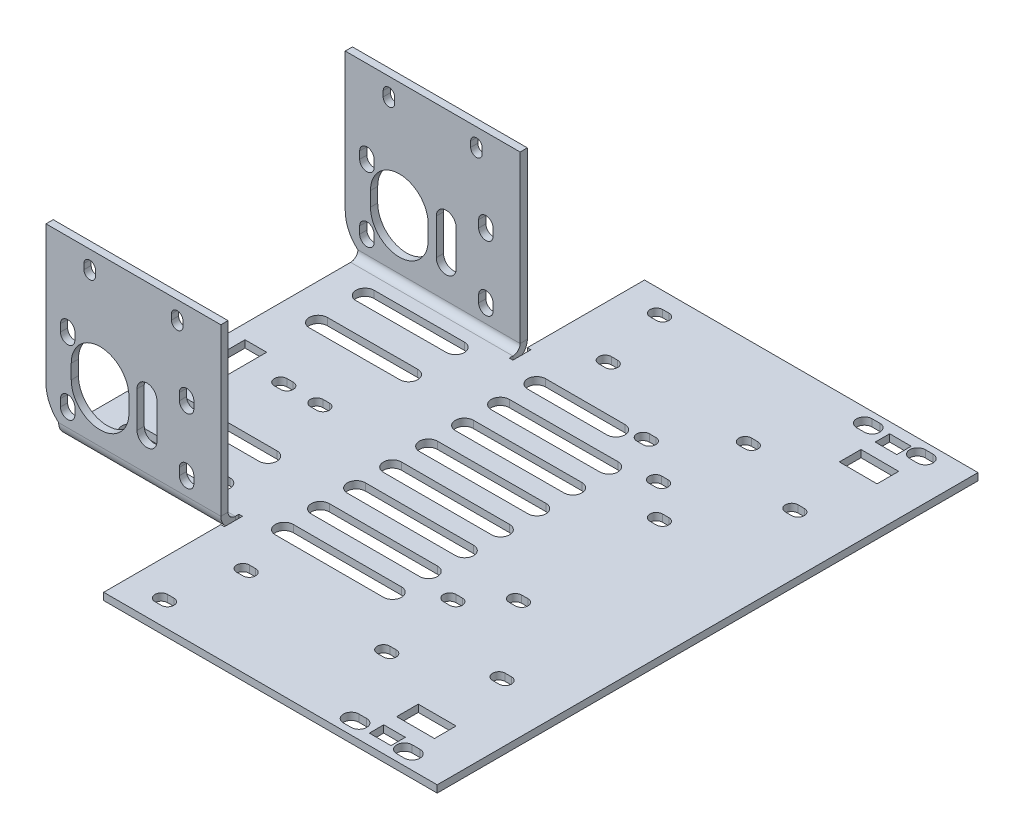
from build123d import *

# Parameters (mm, degrees)
BASE_FLANGE1_DEPTH      = 2
EDGE_FLANGE1_START      = -70.105533496
EDGE_FLANGE1_DEPTH      = 46
EDGE_FLANGE1_START_2    = -25.105533496
EDGE_FLANGE1_2_DEPTH    = 1
EDGE_FLANGE1_3_DEPTH    = 45
SKETCH21_W              = 9.5
SKETCH21_H              = 150
CUT_EXTRUDE1_DEPTH      = 10
SKETCH22_W              = 3.5
SKETCH22_H              = 2
BOSS_EXTRUDE1_DEPTH     = 31
FILLET1_R               = 10
SKETCH23_R              = 2
SKETCH23_R_2            = 8
CUT_EXTRUDE2_DEPTH      = 174
SKETCH24_R              = 2.15
SKETCH24_R_2            = 1.75
SKETCH24_W              = 6
SKETCH24_H              = 10.5
SKETCH24_W_2            = 10.5
SKETCH24_H_2            = 6
SKETCH24_H_3            = 4
CUT_EXTRUDE3_DEPTH      = 174
SKETCH25_W              = 2
SKETCH25_H              = 15
BOSS_EXTRUDE2_DEPTH     = 48.5
SKETCH26_R              = 1.75
CUT_EXTRUDE4_DEPTH      = 10
CUT_EXTRUDE5_DEPTH      = 146.127614744
CUT_EXTRUDE5_DEPTH_BACK = 146.127614744
SKETCH27_R              = 1.5
CUT_EXTRUDE6_START      = -85
CUT_EXTRUDE6_OUTLINE_R  = 1.5
CUT_EXTRUDE6_DEPTH      = 85
CUT_EXTRUDE7_DEPTH      = 124
CUT_EXTRUDE8_DEPTH      = 124
CUT_EXTRUDE9_DEPTH      = 10


# Read off the part's stored shape, not the designer's step: Edge-Flange1, Cut-Extrude6
# Sheet-metal steps are written as plain solids
with BuildPart() as part:
    # Sketch1 → Base-Flange1 (new body)
    with BuildSketch(Plane(origin=(0, 0, 0), x_dir=(1, 0, 0), z_dir=(0, 1, 0))):
        Polygon((-25.105533496, 74.882868115), (-25.105533496, 42.382868115), (-70.105533496, 42.382868115), (-70.105533496, -42.617131885), (-25.105533496, -42.617131885), (-25.105533496, -75.117131885), (76.894466504, -75.117131885), (76.894466504, 74.882868115), align=None)
    extrude(amount=-BASE_FLANGE1_DEPTH)

    # Edge-Flange1 outline → Edge-Flange1 (cut)
    with BuildSketch(Plane.YZ.offset(EDGE_FLANGE1_START)):
        with BuildLine():
            ThreePointArc((0, -41.84696973), (-1.464101615, -40.382868115), (-2, -38.382868115))
            Line((-2, -38.382868115), (-2, -42.382868115))
            Line((-2, -42.382868115), (0, -42.382868115))
            Line((0, -42.382868115), (0, -41.84696973))
        make_face()
        with BuildLine():
            Line((-2, 42.617131885), (-2, 38.617131885))
            ThreePointArc((-2, 38.617131885), (-1.464101615, 40.617131885), (0, 42.081233501))
            Line((0, 42.081233501), (0, 42.617131885))
            Line((0, 42.617131885), (-2, 42.617131885))
        make_face()
    extrude(amount=EDGE_FLANGE1_DEPTH, mode=Mode.SUBTRACT)

    # Edge-Flange1 2 outline → Edge-Flange1 2 (cut)
    with BuildSketch(Plane.YZ.offset(EDGE_FLANGE1_START_2)):
        with BuildLine():
            Line((0, -37.382868115), (-2, -37.382868115))
            Line((-2, -37.382868115), (-2, -38.382868115))
            ThreePointArc((-2, -38.382868115), (-1.464101615, -40.382868115), (0, -41.84696973))
            Line((0, -41.84696973), (0, -37.382868115))
        make_face()
        with BuildLine():
            Line((-2, 38.617131885), (-2, 37.617131885))
            Line((-2, 37.617131885), (0, 37.617131885))
            Line((0, 37.617131885), (0, 42.081233501))
            ThreePointArc((0, 42.081233501), (-1.464101615, 40.617131885), (-2, 38.617131885))
        make_face()
    extrude(amount=EDGE_FLANGE1_2_DEPTH, mode=Mode.SUBTRACT)

    # Edge-Flange1 3 outline → Edge-Flange1 3 (add)
    with BuildSketch(Plane.YZ.offset(EDGE_FLANGE1_START)):
        with BuildLine():
            ThreePointArc((2, -40.382868115), (0.585786438, -39.797081677), (0, -38.382868115))
            Line((0, -38.382868115), (0, -41.84696973))
            ThreePointArc((0, -41.84696973), (0.96472382, -42.24657142), (2, -42.382868115))
            Line((2, -42.382868115), (33, -42.382868115))
            Line((33, -42.382868115), (33, -40.382868115))
            Line((33, -40.382868115), (2, -40.382868115))
        make_face()
        with BuildLine():
            Line((0, 42.081233501), (0, 38.617131885))
            ThreePointArc((0, 38.617131885), (0.585786437, 40.031345448), (2, 40.617131885))
            Line((2, 40.617131885), (33, 40.617131885))
            Line((33, 40.617131885), (33, 42.617131885))
            Line((33, 42.617131885), (2, 42.617131885))
            ThreePointArc((2, 42.617131885), (0.96472382, 42.48083519), (0, 42.081233501))
        make_face()
    extrude(amount=EDGE_FLANGE1_3_DEPTH)

    # Sketch21 → Cut-Extrude1 (cut)
    with BuildSketch(Plane(origin=(0, 0, 0), x_dir=(1, 0, 0), z_dir=(0, 1, 0))):
        with Locations((72.144466504, -0.117131885)):
            Rectangle(SKETCH21_W, SKETCH21_H)
    extrude(amount=-CUT_EXTRUDE1_DEPTH, mode=Mode.SUBTRACT)

    # Sketch22 → Boss-Extrude1 (add)
    with BuildSketch(Plane(origin=(0, 33, 0), x_dir=(1, 0, 0), z_dir=(0, 1, 0))):
        with Locations((-71.855533496, -41.617131885)):
            Rectangle(SKETCH22_W, SKETCH22_H)
        with Locations((-71.855533496, 41.382868115)):
            Rectangle(SKETCH22_W, SKETCH22_H)
    extrude(amount=-BOSS_EXTRUDE1_DEPTH)

    # Fillet1
    # the kernel refuses this fillet: 10 mm, written as the material it takes off along each edge
    with BuildSketch(Plane(origin=(-73.605533496, 2, 21.618776693), x_dir=(1, 0, 0), z_dir=(0, 0, 1)), Plane(origin=(-73.605533496, 2, -61.381223307), x_dir=(1, 0, 0), z_dir=(0, 0, 1))) as fillet1_piece_1:
        with BuildLine():
            CenterArc((10, 7.599342077), FILLET1_R, 180, 49.458398126)
            Line((0, 7.599342077), (-0.2, 7.599342077))
            Line((-0.2, 7.599342077), (-0.2, 0))
            Line((-0.2, 0), (0, -0.2))
            ThreePointArc((0, -0.2), (1.75, -0.2), (3.37, -0.151986842))
            Line((3.37, -0.151986842), (3.5, 0))
        make_face()
    extrude(amount=39.996710384, mode=Mode.SUBTRACT)

    # Sketch23 → Cut-Extrude2 (cut)
    with BuildSketch(Plane.XY.offset(42.617131885)):
        with Locations((-67.605533496, 25)):
            Circle(SKETCH23_R)
        with Locations((-67.605533496, 7)):
            Circle(SKETCH23_R)
        with Locations((-34.605533496, 7)):
            Circle(SKETCH23_R)
        with Locations((-34.605533496, 25)):
            Circle(SKETCH23_R)
        with Locations((-58.605533496, 16)):
            Circle(SKETCH23_R_2)
        with BuildLine():
            Line((-48.355533496, 11), (-48.355533496, 21))
            ThreePointArc((-48.355533496, 21), (-45.605533496, 23.75), (-42.855533496, 21))
            Line((-42.855533496, 21), (-42.855533496, 11))
            ThreePointArc((-42.855533496, 11), (-45.605533496, 8.25), (-48.355533496, 11))
        make_face()
    extrude(amount=-CUT_EXTRUDE2_DEPTH, mode=Mode.SUBTRACT)

    # Sketch24 → Cut-Extrude3 (cut)
    with BuildSketch(Plane(origin=(0, -2, 0), x_dir=(-1, 0, 0), z_dir=(0, -1, 0))):
        with Locations(Location((-55.394466504, -71.117131885, 0), (0, 0, 90))):
            Circle(SKETCH24_R)
        with Locations(Location((-40.614466504, -71.117131885, 0), (0, 0, 90))):
            Circle(SKETCH24_R)
        with Locations(Location((-50.894466504, -40.617131885, 0), (0, 0, 90))):
            Circle(SKETCH24_R_2)
        with Locations(Location((-34.394466504, -19.55983664, 0), (0, 0, 90))):
            Circle(SKETCH24_R_2)
        with Locations(Location((-25.144466504, -28.517131885, 0), (0, 0, 90))):
            Circle(SKETCH24_R_2)
        with Locations(Location((-28.394466504, -50.117131885, 0), (0, 0, 90))):
            Circle(SKETCH24_R_2)
        with Locations(Location((10.605533496, -50.117131885, 0), (0, 0, 90))):
            Circle(SKETCH24_R_2)
        with Locations(Location((14.855533496, -68.517131885, 0), (0, 0, 90))):
            Circle(SKETCH24_R_2)
        with Locations(Location((-13.394466504, 36.882868115, 0), (0, 0, 90))):
            Circle(SKETCH24_R_2)
        with Locations(Location((14.617278303, 68.568355765, 0), (0, 0, 90))):
            Circle(SKETCH24_R_2)
        with Locations(Location((10.431262351, 50.153693931, 0), (0, 0, 90))):
            Circle(SKETCH24_R_2)
        with Locations(Location((-28.568502039, 50.01812999, 0), (0, 0, 90))):
            Circle(SKETCH24_R_2)
        with Locations(Location((-25.243440106, 28.429557477, 0), (0, 0, 90))):
            Circle(SKETCH24_R_2)
        with Locations(Location((-34.462248679, 19.44016336, 0), (0, 0, 90))):
            Circle(SKETCH24_R_2)
        with Locations(Location((-51.035344124, 40.439977417, 0), (0, 0, 90))):
            Circle(SKETCH24_R_2)
        with Locations(Location((-40.861424182, 70.975526422, 0), (0, 0, 90))):
            Circle(SKETCH24_R)
        with Locations(Location((-55.641334892, 70.924151164, 0), (0, 0, 90))):
            Circle(SKETCH24_R)
        with Locations((63.155533496, -0.117131885)):
            Rectangle(SKETCH24_W, SKETCH24_H)
        with Locations((-50.644466504, -61.367131885)):
            Rectangle(SKETCH24_W_2, SKETCH24_H_2)
        with Locations((-48.564466504, -70.117131885)):
            Rectangle(SKETCH24_W, SKETCH24_H_3)
        Polygon((-45.814870276, 71.958314188), (-45.800966282, 67.958338353), (-51.800930034, 67.937482362), (-51.814834028, 71.937458197), align=None)
        Polygon((-45.617932315, 64.208951928), (-45.597076324, 58.208988175), (-56.09701289, 58.172490191), (-56.117868881, 64.172453944), align=None)
    extrude(amount=-CUT_EXTRUDE3_DEPTH, mode=Mode.SUBTRACT)

    # Sketch25 → Boss-Extrude2 (add)
    with BuildSketch(Plane.ZY.offset(73.605533496)):
        with Locations((-41.382868115, 40.5)):
            Rectangle(SKETCH25_W, SKETCH25_H)
        with Locations((41.617131885, 40.5)):
            Rectangle(SKETCH25_W, SKETCH25_H)
    extrude(amount=-BOSS_EXTRUDE2_DEPTH)

    # Sketch26 → Cut-Extrude4 (cut)
    with BuildSketch(Plane(origin=(0, 0, 0), x_dir=(1, 0, 0), z_dir=(0, 1, 0))):
        with Locations(Location((-50.155533496, -0.117131885, 0), (0, 0, 270))):
            Circle(SKETCH26_R)
        with Locations(Location((-40.155533496, -0.117131885, 0), (0, 0, 270))):
            Circle(SKETCH26_R)
    extrude(amount=-CUT_EXTRUDE4_DEPTH, mode=Mode.SUBTRACT)

    # Sketch27 → Cut-Extrude5 (cut, two sides: drawn at the far end of the back side and taken through both)
    with BuildSketch(Plane(origin=(0, 0, 40.617131885), x_dir=(-1, 0, 0), z_dir=(0, 0, -1)).offset(-CUT_EXTRUDE5_DEPTH_BACK)):
        with Locations((61.480533496, 43)):
            Circle(SKETCH27_R)
        with Locations((37.230533496, 43)):
            Circle(SKETCH27_R)
    extrude(amount=CUT_EXTRUDE5_DEPTH + CUT_EXTRUDE5_DEPTH_BACK, mode=Mode.SUBTRACT)

    # Cut-Extrude6 outline → Cut-Extrude6 (cut)
    # profile 1 of 12: a face of its own
    with BuildSketch(Plane(origin=(0, 0, -42.382868115), x_dir=(-1, 0, 0), z_dir=(0, 0, -1)).offset(CUT_EXTRUDE6_START)):
        with BuildLine():
            Line((65.605533496, 25), (65.605533496, 24))
            ThreePointArc((65.605533496, 24), (67.605533496, 22), (69.605533496, 24))
            Line((69.605533496, 24), (69.605533496, 25))
            ThreePointArc((69.605533496, 25), (67.605533496, 23), (65.605533496, 25))
        make_face()
    # profile 2 of 12: a face of its own
    with BuildSketch(Plane(origin=(0, 0, -42.382868115), x_dir=(-1, 0, 0), z_dir=(0, 0, -1)).offset(CUT_EXTRUDE6_START)):
        with BuildLine():
            Line((65.605533496, 26), (65.605533496, 25))
            ThreePointArc((65.605533496, 25), (67.605533496, 27), (69.605533496, 25))
            Line((69.605533496, 25), (69.605533496, 26))
            ThreePointArc((69.605533496, 26), (67.605533496, 28), (65.605533496, 26))
        make_face()
    # profile 3 of 12: a face of its own
    with BuildSketch(Plane(origin=(0, 0, -42.382868115), x_dir=(-1, 0, 0), z_dir=(0, 0, -1)).offset(CUT_EXTRUDE6_START)):
        with BuildLine():
            ThreePointArc((69.605533496, 8), (67.605533496, 10), (65.605533496, 8))
            Line((65.605533496, 8), (65.605533496, 7))
            ThreePointArc((65.605533496, 7), (67.605533496, 9), (69.605533496, 7))
            Line((69.605533496, 7), (69.605533496, 8))
        make_face()
    # profile 4 of 12: a face of its own
    with BuildSketch(Plane(origin=(0, 0, -42.382868115), x_dir=(-1, 0, 0), z_dir=(0, 0, -1)).offset(CUT_EXTRUDE6_START)):
        with BuildLine():
            ThreePointArc((69.605533496, 7), (67.605533496, 5), (65.605533496, 7))
            Line((65.605533496, 7), (65.605533496, 6))
            ThreePointArc((65.605533496, 6), (67.605533496, 4), (69.605533496, 6))
            Line((69.605533496, 6), (69.605533496, 7))
        make_face()
    # profile 5 of 12: a face of its own
    with BuildSketch(Plane(origin=(0, 0, -42.382868115), x_dir=(-1, 0, 0), z_dir=(0, 0, -1)).offset(CUT_EXTRUDE6_START)):
        with BuildLine():
            Line((66.605533496, 16), (66.605533496, 18))
            ThreePointArc((66.605533496, 18), (58.605533496, 26), (50.605533496, 18))
            Line((50.605533496, 18), (50.605533496, 16))
            ThreePointArc((50.605533496, 16), (58.605533496, 24), (66.605533496, 16))
        make_face()
    # profile 6 of 12: a face of its own
    with BuildSketch(Plane(origin=(0, 0, -42.382868115), x_dir=(-1, 0, 0), z_dir=(0, 0, -1)).offset(CUT_EXTRUDE6_START)):
        with BuildLine():
            Line((66.605533496, 14), (66.605533496, 16))
            ThreePointArc((66.605533496, 16), (58.605533496, 8), (50.605533496, 16))
            Line((50.605533496, 16), (50.605533496, 14))
            ThreePointArc((50.605533496, 14), (58.605533496, 6), (66.605533496, 14))
        make_face()
    # profile 7 of 12: a face of its own
    with BuildSketch(Plane(origin=(0, 0, -42.382868115), x_dir=(-1, 0, 0), z_dir=(0, 0, -1)).offset(CUT_EXTRUDE6_START)):
        with BuildLine():
            Line((36.605533496, 7), (36.605533496, 8))
            ThreePointArc((36.605533496, 8), (34.605533496, 10), (32.605533496, 8))
            Line((32.605533496, 8), (32.605533496, 7))
            ThreePointArc((32.605533496, 7), (34.605533496, 9), (36.605533496, 7))
        make_face()
    # profile 8 of 12: a face of its own
    with BuildSketch(Plane(origin=(0, 0, -42.382868115), x_dir=(-1, 0, 0), z_dir=(0, 0, -1)).offset(CUT_EXTRUDE6_START)):
        with BuildLine():
            Line((36.605533496, 6), (36.605533496, 7))
            ThreePointArc((36.605533496, 7), (34.605533496, 5), (32.605533496, 7))
            Line((32.605533496, 7), (32.605533496, 6))
            ThreePointArc((32.605533496, 6), (34.605533496, 4), (36.605533496, 6))
        make_face()
    # profile 9 of 12: a face of its own
    with BuildSketch(Plane(origin=(0, 0, -42.382868115), x_dir=(-1, 0, 0), z_dir=(0, 0, -1)).offset(CUT_EXTRUDE6_START)):
        with BuildLine():
            ThreePointArc((32.605533496, 24), (34.605533496, 22), (36.605533496, 24))
            Line((36.605533496, 24), (36.605533496, 25))
            ThreePointArc((36.605533496, 25), (34.605533496, 23), (32.605533496, 25))
            Line((32.605533496, 25), (32.605533496, 24))
        make_face()
    # profile 10 of 12: a face of its own
    with BuildSketch(Plane(origin=(0, 0, -42.382868115), x_dir=(-1, 0, 0), z_dir=(0, 0, -1)).offset(CUT_EXTRUDE6_START)):
        with BuildLine():
            ThreePointArc((32.605533496, 25), (34.605533496, 27), (36.605533496, 25))
            Line((36.605533496, 25), (36.605533496, 26))
            ThreePointArc((36.605533496, 26), (34.605533496, 28), (32.605533496, 26))
            Line((32.605533496, 26), (32.605533496, 25))
        make_face()
    # profile 11 of 12: a face of its own
    with BuildSketch(Plane(origin=(0, 0, -42.382868115), x_dir=(-1, 0, 0), z_dir=(0, 0, -1)).offset(CUT_EXTRUDE6_START)):
        with BuildLine():
            ThreePointArc((38.829731585, 43.749983763), (38.361385906, 44.881071072), (37.230533461, 45.349983562))
            ThreePointArc((37.230533461, 45.349983562), (36.099681016, 44.881071072), (35.631335337, 43.749983763))
            Line((35.631335337, 43.749983763), (35.63053576, 42.250003418))
            ThreePointArc((35.63053576, 42.250003418), (37.230533461, 40.650005716), (38.830531162, 42.250003418))
            Line((38.830531162, 42.250003418), (38.829731585, 43.749983763))
        make_face()
        with Locations((37.230533496, 43)):
            Circle(CUT_EXTRUDE6_OUTLINE_R, mode=Mode.SUBTRACT)
    # profile 12 of 12: a face of its own
    with BuildSketch(Plane(origin=(0, 0, -42.382868115), x_dir=(-1, 0, 0), z_dir=(0, 0, -1)).offset(CUT_EXTRUDE6_START)):
        with BuildLine():
            ThreePointArc((63.079731655, 43.749983763), (62.611385976, 44.881071072), (61.480533531, 45.349983562))
            ThreePointArc((61.480533531, 45.349983562), (60.349681086, 44.881071072), (59.881335407, 43.749983763))
            Line((59.881335407, 43.749983763), (59.88053583, 42.250003418))
            ThreePointArc((59.88053583, 42.250003418), (61.480533531, 40.650005716), (63.080531232, 42.250003418))
            Line((63.080531232, 42.250003418), (63.079731655, 43.749983763))
        make_face()
        with Locations((61.480533496, 43)):
            Circle(CUT_EXTRUDE6_OUTLINE_R, mode=Mode.SUBTRACT)
    extrude(amount=CUT_EXTRUDE6_DEPTH, mode=Mode.SUBTRACT)

    # Sketch29 → Cut-Extrude7 (cut)
    with BuildSketch(Plane(origin=(0, -2, 0), x_dir=(-1, 0, 0), z_dir=(0, -1, 0))):
        with BuildLine():
            Line((-41.689466504, -68.967131885), (-39.539466504, -68.967131885))
            ThreePointArc((-39.539466504, -68.967131885), (-37.389466504, -71.117131885), (-39.539466504, -73.267131885))
            Line((-39.539466504, -73.267131885), (-41.689466504, -73.267131885))
            ThreePointArc((-41.689466504, -73.267131885), (-43.839466504, -71.117131885), (-41.689466504, -68.967131885))
        make_face()
        with BuildLine():
            Line((-35.269466504, -21.30983664), (-33.519466504, -21.30983664))
            ThreePointArc((-33.519466504, -21.30983664), (-31.769466504, -19.55983664), (-33.519466504, -17.80983664))
            Line((-33.519466504, -17.80983664), (-35.269466504, -17.80983664))
            ThreePointArc((-35.269466504, -17.80983664), (-37.019466504, -19.55983664), (-35.269466504, -21.30983664))
        make_face()
        with BuildLine():
            Line((-12.519466504, 38.632868115), (-14.269466504, 38.632868115))
            ThreePointArc((-14.269466504, 38.632868115), (-16.019466504, 36.882868115), (-14.269466504, 35.132868115))
            Line((-14.269466504, 35.132868115), (-12.519466504, 35.132868115))
            ThreePointArc((-12.519466504, 35.132868115), (-10.769466504, 36.882868115), (-12.519466504, 38.632868115))
        make_face()
        with BuildLine():
            Line((-24.269466504, -30.267131885), (-26.019466504, -30.267131885))
            ThreePointArc((-26.019466504, -30.267131885), (-27.769466504, -28.517131885), (-26.019466504, -26.767131885))
            Line((-26.019466504, -26.767131885), (-24.269466504, -26.767131885))
            ThreePointArc((-24.269466504, -26.767131885), (-22.519466504, -28.517131885), (-24.269466504, -30.267131885))
        make_face()
        with BuildLine():
            Line((-27.519466504, -48.367131885), (-29.269466504, -48.367131885))
            ThreePointArc((-29.269466504, -48.367131885), (-31.019466504, -50.117131885), (-29.269466504, -51.867131885))
            Line((-29.269466504, -51.867131885), (-27.519466504, -51.867131885))
            ThreePointArc((-27.519466504, -51.867131885), (-25.769466504, -50.117131885), (-27.519466504, -48.367131885))
        make_face()
        with BuildLine():
            Line((-56.469466504, -73.267131885), (-54.319466504, -73.267131885))
            ThreePointArc((-54.319466504, -73.267131885), (-52.169466504, -71.117131885), (-54.319466504, -68.967131885))
            Line((-54.319466504, -68.967131885), (-56.469466504, -68.967131885))
            ThreePointArc((-56.469466504, -68.967131885), (-58.619466504, -71.117131885), (-56.469466504, -73.267131885))
        make_face()
        with BuildLine():
            Line((11.480533496, -48.367131885), (9.730533496, -48.367131885))
            ThreePointArc((9.730533496, -48.367131885), (7.980533496, -50.117131885), (9.730533496, -51.867131885))
            Line((9.730533496, -51.867131885), (11.480533496, -51.867131885))
            ThreePointArc((11.480533496, -51.867131885), (13.230533496, -50.117131885), (11.480533496, -48.367131885))
        make_face()
        with BuildLine():
            Line((-51.769466504, -42.367131885), (-50.019466504, -42.367131885))
            ThreePointArc((-50.019466504, -42.367131885), (-48.269466504, -40.617131885), (-50.019466504, -38.867131885))
            Line((-50.019466504, -38.867131885), (-51.769466504, -38.867131885))
            ThreePointArc((-51.769466504, -38.867131885), (-53.519466504, -40.617131885), (-51.769466504, -42.367131885))
        make_face()
        with BuildLine():
            Line((15.730533496, -66.767131885), (13.980533496, -66.767131885))
            ThreePointArc((13.980533496, -66.767131885), (12.230533496, -68.517131885), (13.980533496, -70.267131885))
            Line((13.980533496, -70.267131885), (15.730533496, -70.267131885))
            ThreePointArc((15.730533496, -70.267131885), (17.480533496, -68.517131885), (15.730533496, -66.767131885))
        make_face()
        with BuildLine():
            Line((41.030533496, 1.632868115), (39.280533496, 1.632868115))
            ThreePointArc((39.280533496, 1.632868115), (37.530533496, -0.117131885), (39.280533496, -1.867131885))
            Line((39.280533496, -1.867131885), (41.030533496, -1.867131885))
            ThreePointArc((41.030533496, -1.867131885), (42.780533496, -0.117131885), (41.030533496, 1.632868115))
        make_face()
        with BuildLine():
            Line((51.030533496, -1.867131885), (49.280533496, -1.867131885))
            ThreePointArc((49.280533496, -1.867131885), (47.530533496, -0.117131885), (49.280533496, 1.632868115))
            Line((49.280533496, 1.632868115), (51.030533496, 1.632868115))
            ThreePointArc((51.030533496, 1.632868115), (52.780533496, -0.117131885), (51.030533496, -1.867131885))
        make_face()
        with BuildLine():
            Line((13.736200592, 70.315303694), (15.48619002, 70.321386691))
            ThreePointArc((15.48619002, 70.321386691), (17.242262445, 68.577480261), (15.498356014, 66.821407836))
            Line((15.498356014, 66.821407836), (13.748366587, 66.815324838))
            ThreePointArc((13.748366587, 66.815324838), (11.992294161, 68.559231269), (13.736200592, 70.315303694))
        make_face()
        with BuildLine():
            Line((-29.44957975, 51.765077919), (-27.699590322, 51.771160917))
            ThreePointArc((-27.699590322, 51.771160917), (-25.943517897, 50.027254486), (-27.687424327, 48.271182061))
            Line((-27.687424327, 48.271182061), (-29.437413755, 48.265099064))
            ThreePointArc((-29.437413755, 48.265099064), (-31.19348618, 50.009005494), (-29.44957975, 51.765077919))
        make_face()
        with BuildLine():
            Line((-26.112351822, 26.676526551), (-24.362362395, 26.682609548))
            ThreePointArc((-24.362362395, 26.682609548), (-22.618455964, 28.438681973), (-24.374528389, 30.182588404))
            Line((-24.374528389, 30.182588404), (-26.124517817, 30.176505406))
            ThreePointArc((-26.124517817, 30.176505406), (-27.868424247, 28.420432981), (-26.112351822, 26.676526551))
        make_face()
        with BuildLine():
            Line((9.550184639, 51.90064186), (11.300174067, 51.906724857))
            ThreePointArc((11.300174067, 51.906724857), (13.056246492, 50.162818427), (11.312340062, 48.406746002))
            Line((11.312340062, 48.406746002), (9.562350634, 48.400663005))
            ThreePointArc((9.562350634, 48.400663005), (7.806278209, 50.144569435), (9.550184639, 51.90064186))
        make_face()
        with BuildLine():
            Line((-50.154266413, 38.693029488), (-51.90425584, 38.68694649))
            ThreePointArc((-51.90425584, 38.68694649), (-53.660328265, 40.430852921), (-51.916421835, 42.186925346))
            Line((-51.916421835, 42.186925346), (-50.166432407, 42.193008343))
            ThreePointArc((-50.166432407, 42.193008343), (-48.410359982, 40.449101913), (-50.154266413, 38.693029488))
        make_face()
        with BuildLine():
            Line((-33.581170968, 17.693215431), (-35.331160396, 17.687132434))
            ThreePointArc((-35.331160396, 17.687132434), (-37.087232821, 19.431038864), (-35.34332639, 21.187111289))
            Line((-35.34332639, 21.187111289), (-33.593336963, 21.193194286))
            ThreePointArc((-33.593336963, 21.193194286), (-31.837264537, 19.449287856), (-33.581170968, 17.693215431))
        make_face()
        with BuildLine():
            Line((-54.558867989, 68.777900851), (-56.708855, 68.770427454))
            ThreePointArc((-56.708855, 68.770427454), (-58.866315408, 70.912941069), (-56.723801794, 73.070401477))
            Line((-56.723801794, 73.070401477), (-54.573814783, 73.077874874))
            ThreePointArc((-54.573814783, 73.077874874), (-52.416354375, 70.935361259), (-54.558867989, 68.777900851))
        make_face()
        with BuildLine():
            Line((-39.793904073, 73.129250131), (-41.943891084, 73.121776734))
            ThreePointArc((-41.943891084, 73.121776734), (-44.086404699, 70.964316326), (-41.928944291, 68.821802712))
            Line((-41.928944291, 68.821802712), (-39.77895728, 68.829276109))
            ThreePointArc((-39.77895728, 68.829276109), (-37.636443665, 70.986736517), (-39.793904073, 73.129250131))
        make_face()
    extrude(amount=-CUT_EXTRUDE7_DEPTH, mode=Mode.SUBTRACT)

    # Sketch30 → Cut-Extrude8 (cut)
    with BuildSketch(Plane.XZ.offset(2)):
        with BuildLine():
            Line((-15.105533496, 7.525245209), (14.894466504, 7.525245209))
            ThreePointArc((14.894466504, 7.525245209), (17.394466504, 5.025245209), (14.894466504, 2.525245209))
            Line((14.894466504, 2.525245209), (-15.105533496, 2.525245209))
            ThreePointArc((-15.105533496, 2.525245209), (-17.605533496, 5.025245209), (-15.105533496, 7.525245209))
        make_face()
        with BuildLine():
            Line((-15.105533496, 17.525245209), (14.894466504, 17.525245209))
            ThreePointArc((14.894466504, 17.525245209), (17.394466504, 15.025245209), (14.894466504, 12.525245209))
            Line((14.894466504, 12.525245209), (-15.105533496, 12.525245209))
            ThreePointArc((-15.105533496, 12.525245209), (-17.605533496, 15.025245209), (-15.105533496, 17.525245209))
        make_face()
        with BuildLine():
            Line((-15.105533496, 27.525245209), (14.894466504, 27.525245209))
            ThreePointArc((14.894466504, 27.525245209), (17.394466504, 25.025245209), (14.894466504, 22.525245209))
            Line((14.894466504, 22.525245209), (-15.105533496, 22.525245209))
            ThreePointArc((-15.105533496, 22.525245209), (-17.605533496, 25.025245209), (-15.105533496, 27.525245209))
        make_face()
        with BuildLine():
            Line((-15.105533496, 37.525245209), (14.894466504, 37.525245209))
            ThreePointArc((14.894466504, 37.525245209), (17.394466504, 35.025245209), (14.894466504, 32.525245209))
            Line((14.894466504, 32.525245209), (-15.105533496, 32.525245209))
            ThreePointArc((-15.105533496, 32.525245209), (-17.605533496, 35.025245209), (-15.105533496, 37.525245209))
        make_face()
        with BuildLine():
            Line((-15.130595355, -7.474726875), (14.869237152, -7.574974219))
            ThreePointArc((14.869237152, -7.574974219), (17.37757714, -5.083342122), (14.885945043, -2.575002134))
            Line((14.885945043, -2.575002134), (-15.113887465, -2.474754791))
            ThreePointArc((-15.113887465, -2.474754791), (-17.622227452, -4.966386888), (-15.130595355, -7.474726875))
        make_face()
        with BuildLine():
            Line((-15.164011136, -17.474671044), (14.835821371, -17.574918388))
            ThreePointArc((14.835821371, -17.574918388), (17.344161359, -15.083286291), (14.852529262, -12.574946303))
            Line((14.852529262, -12.574946303), (-15.147303246, -12.47469896))
            ThreePointArc((-15.147303246, -12.47469896), (-17.655643233, -14.966331057), (-15.164011136, -17.474671044))
        make_face()
        with BuildLine():
            Line((-15.197426918, -27.474615213), (14.80240559, -27.574862557))
            ThreePointArc((14.80240559, -27.574862557), (17.310745577, -25.08323046), (14.81911348, -22.574890472))
            Line((14.81911348, -22.574890472), (-15.180719027, -22.474643129))
            ThreePointArc((-15.180719027, -22.474643129), (-17.689059015, -24.966275226), (-15.197426918, -27.474615213))
        make_face()
        with BuildLine():
            Line((-15.105533496, -32.47200893), (6.894466504, -32.47200893))
            ThreePointArc((6.894466504, -32.47200893), (9.394466504, -34.97200893), (6.894466504, -37.47200893))
            Line((6.894466504, -37.47200893), (-15.105533496, -37.47200893))
            ThreePointArc((-15.105533496, -37.47200893), (-17.605533496, -34.97200893), (-15.105533496, -32.47200893))
        make_face()
    extrude(amount=-CUT_EXTRUDE8_DEPTH, mode=Mode.SUBTRACT)

    # Sketch31 → Cut-Extrude9 (cut)
    with BuildSketch(Plane(origin=(0, -2, 0), x_dir=(-1, 0, 0), z_dir=(0, -1, 0))):
        with BuildLine():
            Line((35.052766748, -30.117131885), (60.052766748, -30.117131885))
            ThreePointArc((60.052766748, -30.117131885), (62.552766748, -32.617131885), (60.052766748, -35.117131885))
            Line((60.052766748, -35.117131885), (35.052766748, -35.117131885))
            ThreePointArc((35.052766748, -35.117131885), (32.552766748, -32.617131885), (35.052766748, -30.117131885))
        make_face()
        with BuildLine():
            Line((35.052766748, -17.117131885), (60.052766748, -17.117131885))
            ThreePointArc((60.052766748, -17.117131885), (62.552766748, -19.617131885), (60.052766748, -22.117131885))
            Line((60.052766748, -22.117131885), (35.052766748, -22.117131885))
            ThreePointArc((35.052766748, -22.117131885), (32.552766748, -19.617131885), (35.052766748, -17.117131885))
        make_face()
        with BuildLine():
            Line((35.153209794, 29.99983218), (60.153070217, 29.916292727))
            ThreePointArc((60.153070217, 29.916292727), (62.661410205, 32.407924824), (60.169778108, 34.916264812))
            Line((60.169778108, 34.916264812), (35.169917685, 34.999804265))
            ThreePointArc((35.169917685, 34.999804265), (32.661577697, 32.508172168), (35.153209794, 29.99983218))
        make_face()
        with BuildLine():
            Line((35.109769279, 16.999904761), (60.109629702, 16.916365308))
            ThreePointArc((60.109629702, 16.916365308), (62.617969689, 19.407997405), (60.126337592, 21.916337392))
            Line((60.126337592, 21.916337392), (35.126477169, 21.999876845))
            ThreePointArc((35.126477169, 21.999876845), (32.618137182, 19.508244748), (35.109769279, 16.999904761))
        make_face()
    extrude(amount=-CUT_EXTRUDE9_DEPTH, mode=Mode.SUBTRACT)


solid = part.part
